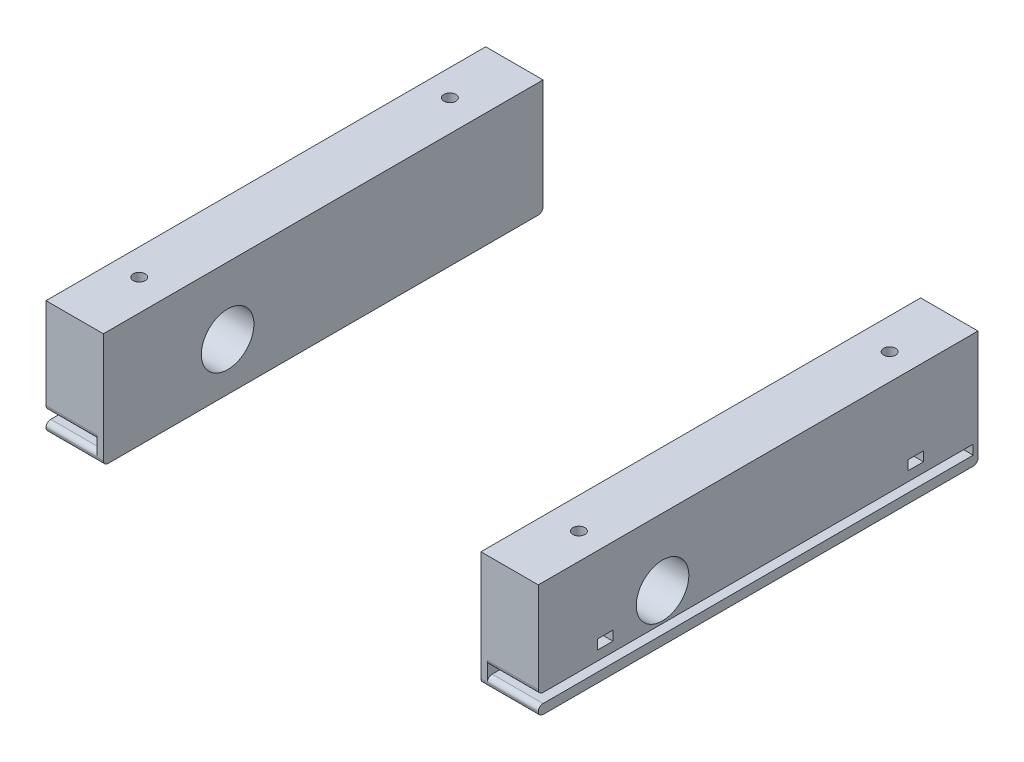
from build123d import *

# Parameters (mm, degrees)
SKETCH3_R           = 1.25
BOSS_EXTRUDE1_DEPTH = 24
SKETCH6_W           = 10.653986256
SKETCH6_H           = 2
CUT_EXTRUDE1_DEPTH  = 91
CUT_EXTRUDE3_REACH  = 57.493
SKETCH7_W           = 3.2
SKETCH7_H           = 2
FILLET1_R           = 1
SKETCH8_R           = 5.5
CUT_EXTRUDE4_DEPTH  = 12


with BuildPart() as part:
    # Sketch3 → Boss-Extrude1 (new body)
    with BuildSketch(Plane.XZ.offset(-15.434699117)):
        Polygon((17.344683291, 34.064867032), (17.344683291, -45.935132968), (17.344683291, -51.935132968), (29.344683291, -51.935132968), (29.344683291, -45.935132968), (29.344683291, 34.064867032), (29.344683291, 40.064867032), (17.344683291, 40.064867032), align=None)
        with Locations((23.844683291, -38.935132968)):
            Circle(SKETCH3_R, mode=Mode.SUBTRACT)
        with Locations((23.844683291, 26.064867032)):
            Circle(SKETCH3_R, mode=Mode.SUBTRACT)
    extrude(amount=BOSS_EXTRUDE1_DEPTH)

    # Sketch6 → Cut-Extrude1 (cut)
    with BuildSketch(Plane.XY.offset(40.064867032)):
        with Locations((24.017690163, -5.565300883)):
            Rectangle(SKETCH6_W, SKETCH6_H)
    extrude(amount=-CUT_EXTRUDE1_DEPTH, mode=Mode.SUBTRACT)

    # Cut-Extrude3: up to this face of the body (flat: up to its plane)
    cut_extrude3_end = Plane(part.part.faces().sort_by_distance((18.690697035, -5.565300883, -5.435132968))[0])
    # Sketch7 → Cut-Extrude3 (cut, up to the picked face)
    with BuildSketch(Plane(origin=(29.344683291, 0, 0), x_dir=(0, 0, -1), z_dir=(1, 0, 0)), mode=Mode.PRIVATE) as cut_extrude3_sk1:
        with Locations((-26.064867032, -1.565300883)):
            Rectangle(SKETCH7_W, SKETCH7_H)
    cut_extrude3_tool1 = split(extrude(cut_extrude3_sk1.sketch, amount=-CUT_EXTRUDE3_REACH, mode=Mode.PRIVATE), bisect_by=cut_extrude3_end, keep=Keep.BOTH, mode=Mode.PRIVATE)
    # Sketch7 → Cut-Extrude3 (cut, up to the picked face)
    with BuildSketch(Plane(origin=(29.344683291, 0, 0), x_dir=(0, 0, -1), z_dir=(1, 0, 0)), mode=Mode.PRIVATE) as cut_extrude3_sk2:
        with Locations((38.935132968, -1.565300883)):
            Rectangle(SKETCH7_W, SKETCH7_H)
    cut_extrude3_tool2 = split(extrude(cut_extrude3_sk2.sketch, amount=-CUT_EXTRUDE3_REACH, mode=Mode.PRIVATE), bisect_by=cut_extrude3_end, keep=Keep.BOTH, mode=Mode.PRIVATE)
    add(cut_extrude3_tool1.solids().sort_by(Axis((29.344683, -1.565301, 26.064867), (-1, 0, 0)))[0], mode=Mode.SUBTRACT)
    add(cut_extrude3_tool2.solids().sort_by(Axis((29.344683, -1.565301, -38.935133), (-1, 0, 0)))[0], mode=Mode.SUBTRACT)

    # Fillet1
    fillet1_edges = [part.edges().sort_by_distance(p)[0] for p in [
        (23.344683291, -8.565300883, -51.935132968),
        (23.344683291, -8.565300883, 40.064867032),
        (24.017690163, -6.565300883, 40.064867032),
        (24.017690163, -4.565300883, 40.064867032),
    ]]
    fillet(fillet1_edges, radius=FILLET1_R - 0.0001)  # a hair under: the kernel refuses the full size

    # Sketch8 → Cut-Extrude4 (cut)
    with BuildSketch(Plane(origin=(29.344683291, 0, 0), x_dir=(0, 0, -1), z_dir=(1, 0, 0))):
        with Locations((-14.064867032, 1.434699117)):
            Circle(SKETCH8_R)
    extrude(amount=-CUT_EXTRUDE4_DEPTH, mode=Mode.SUBTRACT)


with BuildPart() as body_2:
    # Mirror4: mirrored copy
    add(part.part.mirror(Plane.ZY.offset(22.155316709)))


solid = Compound([part.part, body_2.part])
